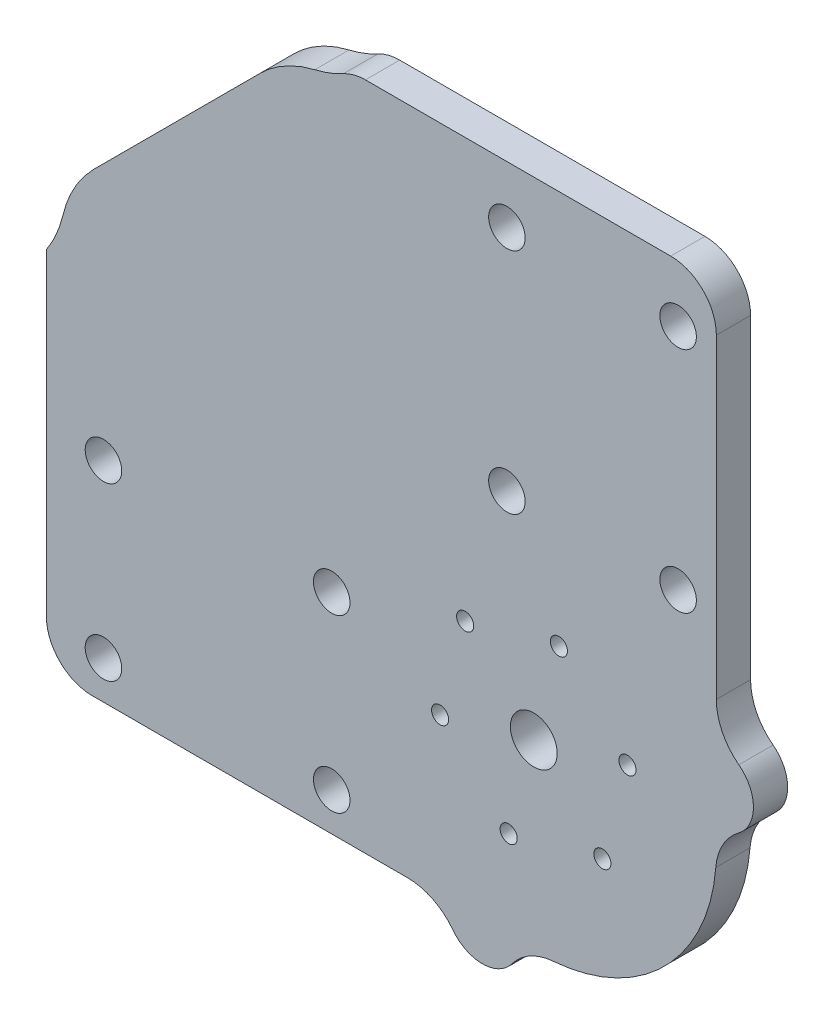
from build123d import *

# Parameters (mm, degrees)
SKETCH1_R           = 0.75
SKETCH1_R_2         = 2.05
SKETCH1_R_3         = 1.6
BOSS_EXTRUDE1_DEPTH = 3
CUT_EXTRUDE2_DEPTH  = 3
FILLET1_START       = -1
FILLET1_DEPTH       = 5
FILLET1_2_DEPTH     = 3


with BuildPart() as part:
    # Sketch1 → Boss-Extrude1 (new body)
    with BuildSketch(Plane.XY):
        with BuildLine():
            Line((76.776362435, -141.065631197), (112.004342533, -141.065631197))
            ThreePointArc((112.004342533, -141.065631197), (114.223405945, -141.585033293), (115.981434881, -143.035328167))
            ThreePointArc((115.981434881, -143.035328167), (118.582167111, -144.31559365), (121.170471257, -143.010385054))
            ThreePointArc((121.170471257, -143.010385054), (122.762010679, -141.623937155), (124.783836945, -141.017757268))
            ThreePointArc((124.783836945, -141.017757268), (134.526700016, -136.525786306), (139.018670978, -126.782923235))
            ThreePointArc((139.018670978, -126.782923235), (139.624850866, -124.761096969), (141.011298764, -123.169557547))
            ThreePointArc((141.011298764, -123.169557547), (142.31650736, -120.5812534), (141.036241877, -117.980521171))
            ThreePointArc((141.036241877, -117.980521171), (139.585947004, -116.222492234), (139.066544907, -114.003428823))
            Line((139.066544907, -114.003428823), (139.066544907, -78.7754981))
            ThreePointArc((139.066544907, -78.7754981), (141.336583349, -75.865660283), (139.066544907, -72.955822465))
            ThreePointArc((139.066544907, -72.955822465), (136.675727861, -69.984491924), (133.029767481, -68.865660283))
            Line((133.029767481, -68.865660283), (117.643399217, -68.865660283))
            ThreePointArc((117.643399217, -68.865660283), (113.997438837, -69.984491924), (111.60662179, -72.955822465))
            ThreePointArc((111.60662179, -72.955822465), (109.382649666, -75.341946816), (110.650765895, -78.347196))
            add(Edge.make_bspline(
                [(110.650765895, -78.347196), (109.91906925, -79.898232812), (107.925256124, -82.271997183), (105.135443821, -83.525315829), (103.882990325, -83.818107321)],
                knots=[-0.902991905, -0.902991905, -0.902991905, -0.902991905, -0.38699657, 0, 0, 0, 0], degree=3, weights=[1, 1, 1, 1, 1]))
            add(Edge.make_bspline(
                [(103.882990325, -83.818107321), (102.079131121, -84.239803321), (100.398199973, -85.1745908), (99.088288993, -86.484502541)],
                knots=[0, 0, 0, 0, 0.557222971, 0.557222971, 0.557222971, 0.557222971], degree=3, weights=[1, 1, 1, 1]))
            Line((99.088288993, -86.484502541), (84.485352307, -101.08744771))
            add(Edge.make_bspline(
                [(84.485352307, -101.08744771), (83.175441742, -102.397359036), (82.240655409, -104.078290075), (81.818960273, -105.882148879)],
                knots=[0.344558041, 0.344558041, 0.344558041, 0.344558041, 0.901042549, 0.901042549, 0.901042549, 0.901042549], degree=3, weights=[1, 1, 1, 1]))
            add(Edge.make_bspline(
                [(81.818960273, -105.882148879), (81.428573164, -107.552083308), (79.976526739, -110.290981661), (77.511343468, -112.101144248), (76.34806998, -112.649918673)],
                knots=[0.442078245, 0.442078245, 0.442078245, 0.442078245, 0.957761165, 1.344523278, 1.344523278, 1.344523278, 1.344523278], degree=3, weights=[1, 1, 1, 1, 1]))
            ThreePointArc((76.34806998, -112.649918673), (73.342799133, -111.381774562), (70.956667683, -113.605784292))
            ThreePointArc((70.956667683, -113.605784292), (67.985343813, -115.996601782), (66.866515059, -119.642557902))
            Line((66.866515059, -119.642557902), (66.866515059, -135.028857587))
            ThreePointArc((66.866515059, -135.028857587), (67.985343813, -138.674813706), (70.956667683, -141.065631197))
            ThreePointArc((70.956667683, -141.065631197), (73.866515059, -143.335707744), (76.776362435, -141.065631197))
        make_face()
        with Locations((129.079908052, -131.091021895)):
            Circle(SKETCH1_R, mode=Mode.SUBTRACT)
        with Locations((120.86953867, -133.290983741)):
            Circle(SKETCH1_R, mode=Mode.SUBTRACT)
        with Locations((114.861843981, -127.277234232)):
            Circle(SKETCH1_R, mode=Mode.SUBTRACT)
        with Locations((117.059092978, -119.070206821)):
            Circle(SKETCH1_R, mode=Mode.SUBTRACT)
        with Locations((125.27217521, -116.866903003)):
            Circle(SKETCH1_R, mode=Mode.SUBTRACT)
        with Locations((123.069502622, -125.080616499)):
            Circle(SKETCH1_R_2, mode=Mode.SUBTRACT)
        with Locations((131.279869898, -122.880652512)):
            Circle(SKETCH1_R, mode=Mode.SUBTRACT)
        with Locations((85.366524977, -122.715631197)):
            Circle(SKETCH1_R_3, mode=Mode.SUBTRACT)
        with Locations((85.366524977, -137.715631197)):
            Circle(SKETCH1_R_3, mode=Mode.SUBTRACT)
        with Locations((105.366524977, -137.715631197)):
            Circle(SKETCH1_R_3, mode=Mode.SUBTRACT)
        with Locations((105.366524977, -122.715631197)):
            Circle(SKETCH1_R_3, mode=Mode.SUBTRACT)
        with Locations((135.716544907, -87.365719383)):
            Circle(SKETCH1_R_3, mode=Mode.SUBTRACT)
        with Locations((120.716544907, -87.365719383)):
            Circle(SKETCH1_R_3, mode=Mode.SUBTRACT)
        with Locations((120.716544907, -107.365719383)):
            Circle(SKETCH1_R_3, mode=Mode.SUBTRACT)
        with Locations((135.716544907, -107.365719383)):
            Circle(SKETCH1_R_3, mode=Mode.SUBTRACT)
    extrude(amount=BOSS_EXTRUDE1_DEPTH)

    # Sketch2 → Cut-Extrude2 (cut)
    with BuildSketch(Plane(origin=(0, 0, 0), x_dir=(-1, 0, 0), z_dir=(0, 0, -1))):
        Polygon((-139.066544907, -82.365719383), (-107.206390326, -82.365719383), (-105.489345494, -66.543961021), (-134.526700016, -61.302844114), (-151.077173689, -66.543961021), align=None)
        Polygon((-64.544828407, -107.48854343), (-80.366589508, -109.20556302), (-80.366640336, -141.065717602), (-64.544901135, -153.076371625), (-59.303757824, -136.525906313), align=None)
    extrude(amount=-CUT_EXTRUDE2_DEPTH, mode=Mode.SUBTRACT)

    # Fillet1: read off the stored shape, not the designer's step
    # Fillet1 outline → Fillet1 (cut)
    with BuildSketch(Plane.XY.offset(FILLET1_START)):
        with BuildLine():
            Line((80.366640336, -141.065631197), (84.366633955, -141.065631197))
            ThreePointArc((84.366633955, -141.065631197), (81.538209086, -139.894060578), (80.366633955, -137.065637579))
            Line((80.366633955, -137.065637579), (80.366640336, -141.065631197))
        make_face()
        with BuildLine():
            add(Edge.make_bspline(
                [(107.206390326, -82.365719383), (106.946532094, -82.541418076), (106.678265015, -82.704743583), (106.402886758, -82.855136258)],
                knots=[-0.365754194, -0.365754194, -0.365754194, -0.365754194, -0.271346383, -0.271346383, -0.271346383, -0.271346383], degree=3))
            ThreePointArc((106.402886758, -82.855136258), (107.330765678, -82.490004449), (108.320125951, -82.365719383))
            Line((108.320125951, -82.365719383), (107.206390326, -82.365719383))
        make_face()
        with BuildLine():
            Line((139.066544907, -82.365719383), (135.066544907, -82.365719383))
            ThreePointArc((135.066544907, -82.365719383), (137.894972032, -83.537292258), (139.066544907, -86.365719383))
            Line((139.066544907, -86.365719383), (139.066544907, -82.365719383))
        make_face()
    extrude(amount=FILLET1_DEPTH, mode=Mode.SUBTRACT)

    # Fillet1 2 outline → Fillet1 2 (add)
    with BuildSketch(Plane.XY):
        with BuildLine():
            ThreePointArc((80.364665709, -109.205354245), (80.366108628, -109.267368328), (80.366589705, -109.329397329))
            Line((80.366589705, -109.329397329), (80.366589508, -109.20556302))
            Line((80.366589508, -109.20556302), (80.364665709, -109.205354245))
        make_face()
    extrude(amount=FILLET1_2_DEPTH)


solid = part.part
